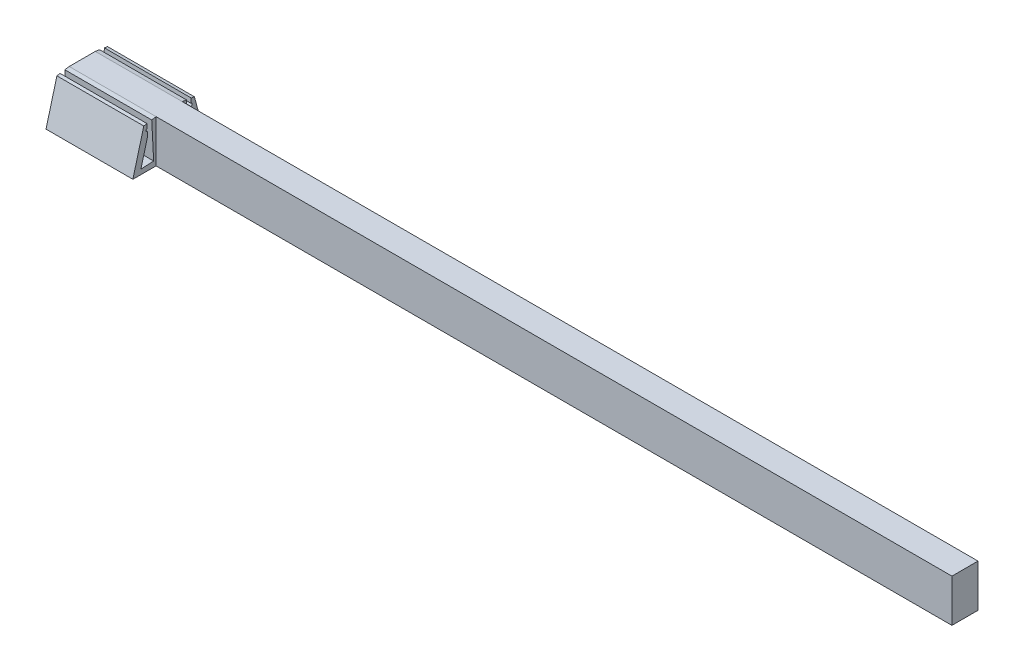
from build123d import *

# Parameters (mm, degrees)
CLIP_1_DEPTH      = 20
SKETCH4_W         = 6.003992509
SKETCH4_H         = 9.824299843
CENTER_BEAM_DEPTH = 203.2


with BuildPart() as part:
    # Sketch1 → Clip #1 (new body)
    with BuildSketch(Plane(origin=(0, 0, 0), x_dir=(0, 0, -1), z_dir=(1, 0, 0))):
        with BuildLine():
            Line((6.081551938, 6.841542851), (7.61911384, 1.103283712))
            Line((7.61911384, 1.103283712), (4.687365208, 1.256930148))
            Line((4.687365208, 1.256930148), (5.127959845, 9.663976652))
            Line((5.127959845, 9.663976652), (4.1299561, 9.824299843))
            Line((4.1299561, 9.824299843), (-1.874036409, 9.824299843))
            Line((-1.874036409, 9.824299843), (-2.872040155, 9.663976652))
            Line((-2.872040155, 9.663976652), (-2.431445517, 1.256930148))
            Line((-2.431445517, 1.256930148), (-5.36319415, 1.103283712))
            Line((-5.36319415, 1.103283712), (-3.825632248, 6.841542851))
            Line((-3.825632248, 6.841542851), (-3.879292118, 7.86543416))
            ThreePointArc((-3.879292118, 7.86543416), (-4.194581765, 8.149322234), (-3.910693691, 8.464611881))
            Line((-3.910693691, 8.464611881), (-3.964353561, 9.488503191))
            Line((-3.964353561, 9.488503191), (-4.701004321, 9.370164756))
            Line((-4.701004321, 9.370164756), (-7.2117324, 0))
            Line((-7.2117324, 0), (-2.365572599, 0))
            Line((-2.365572599, 0), (4.62149229, 0))
            Line((4.62149229, 0), (9.46765209, 0))
            Line((9.46765209, 0), (6.956924011, 9.370164756))
            Line((6.956924011, 9.370164756), (6.220273251, 9.488503191))
            Line((6.220273251, 9.488503191), (6.166613382, 8.464611881))
            ThreePointArc((6.166613382, 8.464611881), (6.450501455, 8.149322234), (6.135211808, 7.86543416))
            Line((6.135211808, 7.86543416), (6.081551938, 6.841542851))
        make_face()
    extrude(amount=CLIP_1_DEPTH)

    # Sketch4 → Center beam (add)
    with BuildSketch(Plane(origin=(0, 0, 0), x_dir=(0, 0, -1), z_dir=(1, 0, 0))):
        with Locations((1.127959845, 4.912149922)):
            Rectangle(SKETCH4_W, SKETCH4_H)
    extrude(amount=CENTER_BEAM_DEPTH)


solid = part.part
